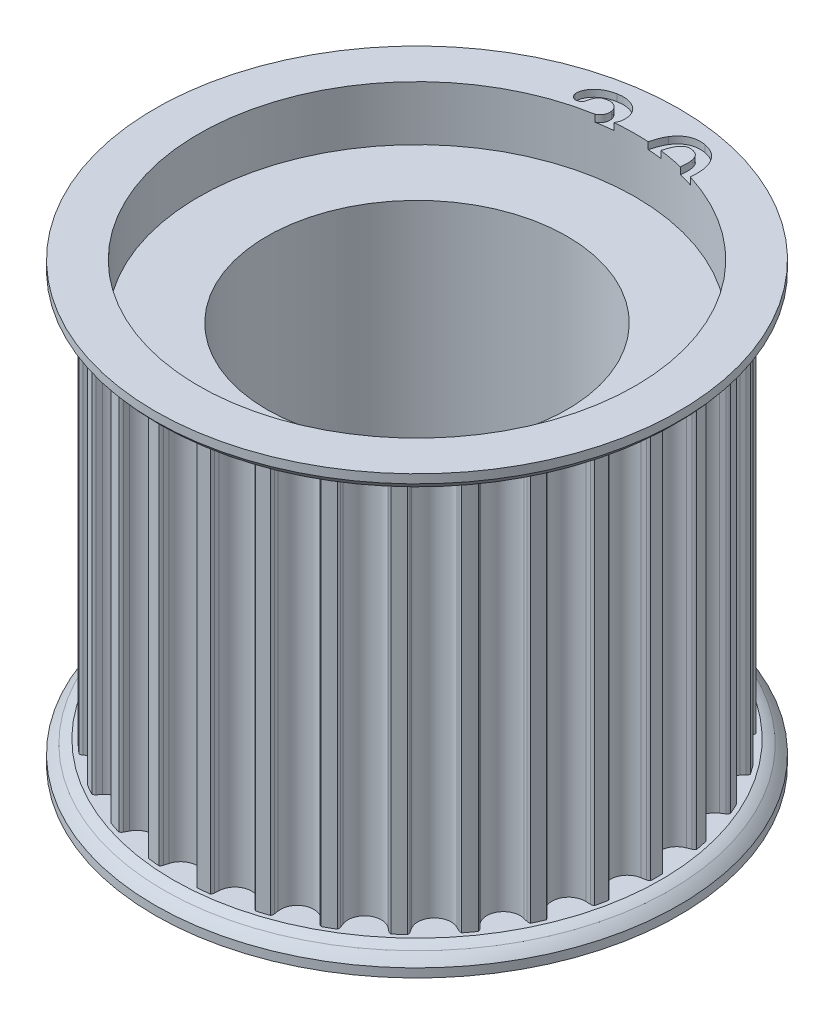
from build123d import *

# Parameters (mm, degrees)
SKETCH1_R                    = 13.942945337
TOOTHOD_DEPTH                = 11.43
TOOTHPROFILE_DEPTH           = 23.791585055
TOOTHPATTERN_COUNT           = 30
BORE_DEPTH                   = 26.016098817
BORE_DEPTH_BACK              = 26.016098817
SKETCH7_R                    = 8.73125
LARGE_TOOTH_COUNT_DEPTH      = 34.311787703
LARGE_TOOTH_COUNT_DEPTH_BACK = 0.4
SKETCH14_W                   = 12.7
SKETCH14_H                   = 3.175


with BuildPart() as part:
    # Sketch1 → ToothOD (new, symmetric)
    with BuildSketch(Plane(origin=(0, 0, 0), x_dir=(1, 0, 0), z_dir=(0, 1, 0))):
        Circle(SKETCH1_R)
    extrude(amount=TOOTHOD_DEPTH, both=True)

    # Sketch2 → ToothProfile (cut, symmetric)
    with BuildSketch(Plane(origin=(0, 0, 0), x_dir=(1, 0, 0), z_dir=(0, 1, 0))):
        with BuildLine():
            ThreePointArc((-0.937033068, 13.493007333), (-0.590385173, 12.974832723), (0, 12.774545337))
            ThreePointArc((0, 12.774545337), (0.590385173, 12.974832723), (0.937033068, 13.493007333))
            ThreePointArc((0.937033068, 13.493007333), (0.971699064, 13.619118795), (1.007805813, 13.744825337))
            ThreePointArc((1.007805813, 13.744825337), (1.04827578, 13.830028138), (1.113221937, 13.898433782))
            ThreePointArc((1.113221937, 13.898433782), (0, 13.942945337), (-1.113221937, 13.898433782))
            ThreePointArc((-1.113221937, 13.898433782), (-1.04827578, 13.830028138), (-1.007805813, 13.744825337))
            ThreePointArc((-1.007805813, 13.744825337), (-0.971699064, 13.619118795), (-0.937033068, 13.493007333))
        make_face()
    toothprofile = extrude(amount=TOOTHPROFILE_DEPTH, both=True, mode=Mode.SUBTRACT)

    # ToothPattern: ToothProfile ×30 about axis
    toothpattern_axis = Axis((0, 11.43, 0), (0, -1, 0))
    for i in range(1, TOOTHPATTERN_COUNT):
        add(toothprofile.rotate(toothpattern_axis, i * 360 / TOOTHPATTERN_COUNT), mode=Mode.SUBTRACT)

    # Sketch4 → Flange (revolve)
    with BuildSketch(Plane.XY):
        with BuildLine():
            Line((0, -11.43), (14.196945337, -11.43))
            ThreePointArc((14.196945337, -11.43), (14.471862303, -11.541433628), (14.732, -11.684))
            ThreePointArc((14.732, -11.684), (15.000284982, -11.923715018), (15.24, -12.192))
            Line((15.24, -12.192), (15.24, -12.7))
            Line((15.24, -12.7), (0, -12.7))
            Line((0, -12.7), (0, -11.43))
        make_face()
        with BuildLine():
            Line((15.24, 12.7), (15.24, 12.192))
            ThreePointArc((15.24, 12.192), (15.000284982, 11.923715018), (14.732, 11.684))
            ThreePointArc((14.732, 11.684), (14.471862303, 11.541433628), (14.196945337, 11.43))
            Line((14.196945337, 11.43), (0, 11.43))
            Line((0, 11.43), (0, 12.7))
            Line((0, 12.7), (15.24, 12.7))
        make_face()
    revolve(axis=Axis((0, 8.73125, 0), (0, -1, 0)))

    # Sketch7 → Bore (cut, two sides: drawn at the far end of the back side and taken through both)
    with BuildSketch(Plane.XZ.offset(-BORE_DEPTH_BACK)):
        Circle(SKETCH7_R)
    extrude(amount=BORE_DEPTH + BORE_DEPTH_BACK, mode=Mode.SUBTRACT)

    # Sketch9 → Large Tooth Count (cut, two sides: drawn at the far end of the back side and taken through both)
    # profile 1 of 2: a face of its own
    with BuildSketch(Plane(origin=(0, 12.7, 0), x_dir=(1, 0, 0), z_dir=(0, 1, 0)).offset(-LARGE_TOOTH_COUNT_DEPTH_BACK)):
        with BuildLine():
            add(Edge.make_bspline(
                [(-2.395395166, 12.44030561), (-2.351764935, 12.449788273), (-2.26636482, 12.468349267), (-2.148342517, 12.521687794), (-2.042804555, 12.591006059), (-1.96740896, 12.663473497), (-1.915871931, 12.728738206), (-1.883660529, 12.781439315), (-1.858242003, 12.837454575), (-1.840411306, 12.896637263), (-1.829894588, 12.959037271), (-1.825356933, 13.024243133), (-1.828016507, 13.092828085), (-1.835316428, 13.138960651), (-1.839075635, 13.162717329)],
                knots=[0, 0, 0, 0, 1.56408417, 3.061477405, 4.516692484, 5.980328475, 6.71001621, 7.432406507, 8.143441474, 8.864242186, 9.596246751, 10.361021371, 11.155982632, 12, 12, 12, 12], degree=3))
            add(Edge.make_bspline(
                [(-1.839075635, 13.162717329), (-1.847468614, 13.198321462), (-1.863918276, 13.268103117), (-1.912945679, 13.363762957), (-1.979770738, 13.4477246), (-2.063508364, 13.518748482), (-2.161688264, 13.573950381), (-2.272366388, 13.606154076), (-2.39306776, 13.616531188), (-2.474963903, 13.604676737), (-2.517731885, 13.598486079)],
                knots=[0, 0, 0, 0, 0.970242947, 1.901609501, 2.831594879, 3.809017159, 4.805027202, 5.804681963, 6.853556249, 8, 8, 8, 8], degree=3))
            add(Edge.make_bspline(
                [(-2.517731885, 13.598486079), (-2.546415601, 13.592694971), (-2.601323677, 13.581609287), (-2.678208847, 13.55850786), (-2.746350603, 13.530836409), (-2.805384858, 13.497992457), (-2.855844248, 13.460479936), (-2.900373354, 13.421487835), (-2.937064484, 13.378096327), (-2.978986878, 13.315102944), (-3.020518734, 13.221832551), (-3.059478235, 13.098283973), (-3.093381877, 12.968046045), (-3.114639047, 12.880861708), (-3.124950635, 12.838569673)],
                knots=[0, 0, 0, 0, 0.994372717, 1.903487376, 2.72466848, 3.490292993, 4.192582868, 4.858964158, 5.497730828, 6.117954991, 7.426137334, 8.949273991, 10.520130824, 12, 12, 12, 12], degree=3))
            add(Edge.make_bspline(
                [(-3.124950635, 12.838569673), (-3.129102288, 12.828888525), (-3.137555782, 12.809176013), (-3.156946896, 12.781271911), (-3.184316211, 12.757087617), (-3.228365663, 12.724989234), (-3.296869514, 12.693279737), (-3.356792915, 12.679657358), (-3.388376416, 12.672477485)],
                knots=[0, 0, 0, 0, 0.583215557, 1.187529019, 1.864732099, 2.597558886, 4.206693834, 6, 6, 6, 6], degree=3))
            add(Edge.make_bspline(
                [(-3.388376416, 12.672477485), (-3.408006408, 12.670159859), (-3.447059185, 12.665549071), (-3.507022694, 12.67355228), (-3.566425146, 12.693523488), (-3.623655514, 12.725811297), (-3.677136394, 12.767570228), (-3.718303855, 12.823277744), (-3.750834042, 12.887407726), (-3.76148388, 12.935253341), (-3.766995166, 12.960013423)],
                knots=[0, 0, 0, 0, 0.895545026, 1.78163704, 2.722927117, 3.728259503, 4.757347425, 5.780279766, 6.851295854, 8, 8, 8, 8], degree=3))
            add(Edge.make_bspline(
                [(-3.766995166, 12.960013423), (-3.770411448, 12.985862618), (-3.777384046, 13.038620566), (-3.773919219, 13.121047331), (-3.759263587, 13.207335205), (-3.733005125, 13.296987906), (-3.696578666, 13.389099655), (-3.647932397, 13.480993304), (-3.588113382, 13.572735702), (-3.518084365, 13.664428947), (-3.436036471, 13.753650839), (-3.341843972, 13.838087605), (-3.234599648, 13.915677391), (-3.115927699, 13.987966339), (-2.986130398, 14.052791424), (-2.845920922, 14.108605922), (-2.695743201, 14.153101315), (-2.591436102, 14.174340706), (-2.538270166, 14.185166548)],
                knots=[0, 0, 0, 0, 0.657648442, 1.342253878, 2.074039585, 2.864148476, 3.697712609, 4.572156031, 5.485651204, 6.461680898, 7.483386968, 8.543039874, 9.651430748, 10.822328438, 12.049685541, 13.311901225, 14.629860395, 16, 16, 16, 16], degree=3))
            add(Edge.make_bspline(
                [(-2.538270166, 14.185166548), (-2.491323817, 14.192598445), (-2.399252753, 14.207173862), (-2.262542202, 14.218659249), (-2.130523977, 14.21615243), (-2.003510296, 14.205171913), (-1.88150585, 14.182798989), (-1.765492151, 14.149880101), (-1.655706619, 14.106812961), (-1.552939002, 14.053959346), (-1.457386459, 13.992879421), (-1.37142964, 13.922784448), (-1.294282136, 13.845573559), (-1.228614102, 13.759473777), (-1.172184525, 13.667230001), (-1.12544845, 13.569517), (-1.089148427, 13.465869789), (-1.073635459, 13.393899723), (-1.065764698, 13.357384517)],
                knots=[0, 0, 0, 0, 1.205963252, 2.365132143, 3.475536425, 4.552557823, 5.596986774, 6.617881568, 7.608112011, 8.584359298, 9.54600503, 10.480268389, 11.393565618, 12.30907766, 13.221030907, 14.133203077, 15.052849641, 16, 16, 16, 16], degree=3))
            add(Edge.make_bspline(
                [(-1.065764698, 13.357384517), (-1.058444517, 13.309874096), (-1.044223716, 13.217576343), (-1.046060272, 13.080838704), (-1.062999475, 12.95140843), (-1.100190083, 12.829006806), (-1.152753369, 12.710344301), (-1.218197892, 12.591451706), (-1.297956271, 12.471597027), (-1.359266437, 12.394328645), (-1.390805323, 12.35458061)],
                knots=[0, 0, 0, 0, 1.053632123, 2.04687467, 2.990381272, 3.91042597, 4.843946409, 5.835317206, 6.886454128, 8, 8, 8, 8], degree=3))
            add(Edge.make_bspline(
                [(-1.390805323, 12.35458061), (-1.350412041, 12.340545314), (-1.270980886, 12.312945681), (-1.157752588, 12.262979632), (-1.052586502, 12.206626181), (-0.956144809, 12.143795096), (-0.867013097, 12.07655175), (-0.788401054, 12.001417094), (-0.716721652, 11.921931915), (-0.655517404, 11.83490394), (-0.602231291, 11.742811281), (-0.559592513, 11.644667954), (-0.524881708, 11.541361692), (-0.509910371, 11.46953943), (-0.502301416, 11.43303686)],
                knots=[0, 0, 0, 0, 1.139891914, 2.24153439, 3.296229475, 4.31773043, 5.308329865, 6.268443975, 7.212979858, 8.157782482, 9.099914282, 10.045216846, 11.006511264, 12, 12, 12, 12], degree=3))
            add(Edge.make_bspline(
                [(-0.502301416, 11.43303686), (-0.495319451, 11.388490119), (-0.481414307, 11.299771707), (-0.478916202, 11.164667165), (-0.488260491, 11.029415833), (-0.51276627, 10.894860542), (-0.549846959, 10.762327063), (-0.602249742, 10.634138329), (-0.667869204, 10.510393731), (-0.746222597, 10.391484268), (-0.838347041, 10.280067973), (-0.942787724, 10.17663575), (-1.059215889, 10.081986318), (-1.186989884, 9.996266633), (-1.325681923, 9.920701304), (-1.475651654, 9.858916788), (-1.635068246, 9.806633217), (-1.746512528, 9.78436586), (-1.803356885, 9.773007954)],
                knots=[0, 0, 0, 0, 0.919196757, 1.830654129, 2.750292315, 3.682047259, 4.616530511, 5.553871909, 6.502170786, 7.470871317, 8.454707972, 9.446890999, 10.465768377, 11.511964047, 12.582837701, 13.682741819, 14.818036711, 16, 16, 16, 16], degree=3))
            add(Edge.make_bspline(
                [(-1.803356885, 9.773007954), (-1.861273881, 9.764095157), (-1.97457734, 9.746658985), (-2.143413115, 9.740832432), (-2.305966452, 9.751048954), (-2.461225746, 9.778889999), (-2.606979598, 9.821119725), (-2.742928406, 9.873090337), (-2.868308727, 9.934276457), (-2.981900004, 10.005903776), (-3.083286845, 10.085279788), (-3.175837052, 10.166704637), (-3.256567319, 10.253286516), (-3.326556915, 10.341337364), (-3.383639504, 10.428572924), (-3.428783069, 10.510279282), (-3.462785872, 10.585170072), (-3.474766814, 10.634802087), (-3.480352198, 10.657939985)],
                knots=[0, 0, 0, 0, 1.358988971, 2.658600414, 3.911700577, 5.132627013, 6.311151581, 7.428568411, 8.506776026, 9.543649576, 10.538503265, 11.492538343, 12.401569204, 13.281931069, 14.10006001, 14.817332809, 15.448653585, 16, 16, 16, 16], degree=3))
            add(Edge.make_bspline(
                [(-3.480352198, 10.657939985), (-3.483746984, 10.68497257), (-3.490277506, 10.736974917), (-3.483346924, 10.814189742), (-3.459407148, 10.885488216), (-3.420429227, 10.949801807), (-3.370073369, 11.006058136), (-3.308307685, 11.050542415), (-3.238271172, 11.084475844), (-3.186891971, 11.095909843), (-3.160669385, 11.101745454)],
                knots=[0, 0, 0, 0, 1.065165672, 2.049049875, 3.00773798, 3.985592617, 4.976224793, 5.944087156, 6.950716419, 8, 8, 8, 8], degree=3))
            add(Edge.make_bspline(
                [(-3.160669385, 11.101745454), (-3.132597094, 11.104682386), (-3.07565053, 11.110640153), (-3.005449066, 11.091014031), (-2.953679925, 11.068571016), (-2.91939304, 11.047595496), (-2.891337116, 11.023070197), (-2.877833025, 11.003226451), (-2.87134751, 10.993696235)],
                knots=[0, 0, 0, 0, 1.550673656, 3.145647615, 3.957272918, 4.675311549, 5.363801208, 6, 6, 6, 6], degree=3))
            add(Edge.make_bspline(
                [(-2.87134751, 10.993696235), (-2.834765451, 10.934439869), (-2.765769991, 10.822679615), (-2.654254449, 10.673931939), (-2.546873402, 10.549804547), (-2.454600564, 10.465849729), (-2.379391167, 10.412984746), (-2.320630434, 10.38270277), (-2.259082437, 10.358414541), (-2.19377006, 10.341195919), (-2.12514281, 10.331648111), (-2.053345183, 10.329022341), (-1.978350806, 10.333749213), (-1.927728345, 10.341432664), (-1.901583448, 10.345400923)],
                knots=[0, 0, 0, 0, 1.989651524, 3.75257504, 5.30775678, 6.675689646, 7.305821198, 7.929950262, 8.560368956, 9.193937615, 9.855728221, 10.536870827, 11.244340126, 12, 12, 12, 12], degree=3))
            add(Edge.make_bspline(
                [(-1.901583448, 10.345400923), (-1.871644399, 10.352199583), (-1.811653801, 10.36582245), (-1.724531025, 10.397969414), (-1.641916359, 10.442636299), (-1.563158271, 10.496780316), (-1.491100009, 10.561890428), (-1.427079449, 10.636365346), (-1.373201458, 10.72071369), (-1.328532708, 10.813025229), (-1.296080307, 10.912955075), (-1.279366413, 11.018302819), (-1.277092498, 11.127852865), (-1.287926429, 11.200953457), (-1.293471729, 11.238369673)],
                knots=[0, 0, 0, 0, 0.918783497, 1.841019456, 2.770121856, 3.724533536, 4.696473957, 5.670047891, 6.656552307, 7.685126467, 8.733743146, 9.79028542, 10.868967352, 12, 12, 12, 12], degree=3))
            add(Edge.make_bspline(
                [(-1.293471729, 11.238369673), (-1.298936686, 11.265876176), (-1.30961674, 11.319631579), (-1.333478309, 11.396401406), (-1.360287624, 11.468479114), (-1.394965812, 11.533732243), (-1.433076599, 11.593785038), (-1.476357011, 11.648422925), (-1.525805682, 11.69629192), (-1.579318811, 11.739547501), (-1.637253652, 11.775881164), (-1.698731759, 11.806115638), (-1.76434029, 11.827990482), (-1.83303783, 11.844288015), (-1.905487999, 11.853175874), (-1.98114044, 11.854782163), (-2.060573072, 11.849194939), (-2.114159971, 11.840923764), (-2.141792041, 11.836658735)],
                knots=[0, 0, 0, 0, 1.142167213, 2.232114242, 3.272952444, 4.271354239, 5.237162538, 6.16931723, 7.104388237, 8.036542928, 8.968855492, 9.885808178, 10.82190168, 11.781211808, 12.759285311, 13.790748962, 14.860800298, 16, 16, 16, 16], degree=3))
            add(Edge.make_bspline(
                [(-2.141792041, 11.836658735), (-2.152794304, 11.834231238), (-2.177762529, 11.828722342), (-2.219583134, 11.820746399), (-2.268450918, 11.806036359), (-2.322602613, 11.792515486), (-2.374969303, 11.777315582), (-2.420194021, 11.766479519), (-2.454197188, 11.756940782), (-2.473367184, 11.752663579), (-2.481120166, 11.750933735)],
                knots=[0, 0, 0, 0, 0.772488785, 1.753064323, 2.916415325, 4.267721891, 5.579625089, 6.653636691, 7.455485957, 8, 8, 8, 8], degree=3))
            add(Edge.make_bspline(
                [(-2.481120166, 11.750933735), (-2.506960456, 11.746913438), (-2.556158075, 11.739259148), (-2.627480161, 11.7445519), (-2.692385424, 11.758886393), (-2.748894318, 11.788116673), (-2.797532533, 11.827971419), (-2.835684342, 11.879578873), (-2.863495022, 11.941556302), (-2.873931957, 11.987031385), (-2.879384229, 12.010787642)],
                knots=[0, 0, 0, 0, 1.158395447, 2.205482207, 3.158342672, 4.093034092, 5.004217035, 5.930162721, 6.91871368, 8, 8, 8, 8], degree=3))
            add(Edge.make_bspline(
                [(-2.879384229, 12.010787642), (-2.882631581, 12.034581517), (-2.888938576, 12.080793902), (-2.878805561, 12.149340934), (-2.856720158, 12.213565122), (-2.817758689, 12.271771874), (-2.764205594, 12.323365118), (-2.69486753, 12.365228304), (-2.61067647, 12.39742537), (-2.548927529, 12.410824563), (-2.515945948, 12.417981392)],
                knots=[0, 0, 0, 0, 0.930670598, 1.807545321, 2.668967297, 3.556120476, 4.506850782, 5.542439393, 6.687358266, 8, 8, 8, 8], degree=3))
            Line((-2.515945948, 12.417981392), (-2.395395166, 12.44030561))
        make_face()
    # profile 2 of 2: a face of its own
    with BuildSketch(Plane(origin=(0, 12.7, 0), x_dir=(1, 0, 0), z_dir=(0, 1, 0)).offset(-LARGE_TOOTH_COUNT_DEPTH_BACK)):
        with BuildLine():
            add(Edge.make_bspline(
                [(3.7004625, 11.677153906), (3.686264675, 11.601404519), (3.658870865, 11.455250838), (3.60823368, 11.246398968), (3.555331302, 11.054842095), (3.497140597, 10.879874057), (3.43226392, 10.718370387), (3.354284746, 10.5696501), (3.267863441, 10.429406438), (3.200079147, 10.344222093), (3.166467187, 10.301982031)],
                knots=[0, 0, 0, 0, 1.239292749, 2.391137464, 3.455110319, 4.434576526, 5.35558113, 6.250576262, 7.132519381, 8, 8, 8, 8], degree=3))
            add(Edge.make_bspline(
                [(3.166467187, 10.301982031), (3.144198164, 10.275762567), (3.099982848, 10.223703623), (3.028150759, 10.152099925), (2.955162603, 10.084262728), (2.878202286, 10.023683343), (2.798344121, 9.969152553), (2.716313748, 9.919700373), (2.631008556, 9.876989925), (2.515006197, 9.826838731), (2.364496556, 9.780916237), (2.178286013, 9.751180687), (1.987209688, 9.746705952), (1.860205836, 9.764969839), (1.795760156, 9.7742375)],
                knots=[0, 0, 0, 0, 0.801914036, 1.592206392, 2.363614895, 3.12467816, 3.873679032, 4.617741915, 5.356605588, 6.096739935, 7.563535306, 9.011766561, 10.483677989, 12, 12, 12, 12], degree=3))
            add(Edge.make_bspline(
                [(1.795760156, 9.7742375), (1.758691219, 9.781631242), (1.685306753, 9.796268451), (1.579017325, 9.829261717), (1.47669898, 9.867783469), (1.380044445, 9.916590329), (1.285561627, 9.968935939), (1.19738272, 10.03240735), (1.113160926, 10.102133163), (1.033456371, 10.178910635), (0.960133443, 10.26276729), (0.891273319, 10.351207984), (0.831227587, 10.446296886), (0.776093193, 10.545504009), (0.728929808, 10.650561093), (0.688129265, 10.760416841), (0.652394743, 10.875273666), (0.635471729, 10.954585081), (0.626864062, 10.994925781)],
                knots=[0, 0, 0, 0, 1.006831006, 1.993198655, 2.962670514, 3.917125603, 4.876579595, 5.838523297, 6.807605523, 7.789496056, 8.784377988, 9.774567055, 10.773710418, 11.778570219, 12.797611708, 13.839467994, 14.90107403, 16, 16, 16, 16], degree=3))
            add(Edge.make_bspline(
                [(0.626864062, 10.994925781), (0.619759274, 11.038311971), (0.605309332, 11.126552166), (0.593814246, 11.262326323), (0.586896602, 11.40293425), (0.589152193, 11.548709409), (0.598648225, 11.69935456), (0.612502788, 11.855226338), (0.63412349, 12.015735441), (0.65299437, 12.123994877), (0.662582812, 12.179002344)],
                knots=[0, 0, 0, 0, 0.885671199, 1.801305883, 2.744009489, 3.721842217, 4.73736564, 5.785511931, 6.874801293, 8, 8, 8, 8], degree=3))
            add(Edge.make_bspline(
                [(0.662582812, 12.179002344), (0.67581353, 12.249342885), (0.701685694, 12.38689113), (0.747177039, 12.586095152), (0.796532307, 12.77366033), (0.848666183, 12.949364152), (0.905121765, 13.112699737), (0.967526733, 13.262167279), (1.031048043, 13.399729724), (1.08126072, 13.48342074), (1.105495312, 13.523813281)],
                knots=[0, 0, 0, 0, 1.20660685, 2.359473668, 3.444007557, 4.475997896, 5.44888863, 6.355661217, 7.206378115, 8, 8, 8, 8], degree=3))
            add(Edge.make_bspline(
                [(1.105495312, 13.523813281), (1.126834416, 13.556524286), (1.168832216, 13.62090329), (1.237568178, 13.7114371), (1.311190111, 13.793654963), (1.38803844, 13.868988013), (1.468633631, 13.937022551), (1.552525179, 13.998072286), (1.640742164, 14.051107199), (1.732849104, 14.096474687), (1.827852868, 14.135111111), (1.926359063, 14.164557494), (2.026980006, 14.186607394), (2.130423165, 14.202480291), (2.236825853, 14.208279031), (2.345683237, 14.206147175), (2.457347204, 14.197656756), (2.53193532, 14.185467192), (2.569964062, 14.179252344)],
                knots=[0, 0, 0, 0, 1.092656575, 2.150473306, 3.176936881, 4.178220762, 5.159348138, 6.12565659, 7.078409122, 8.035701623, 8.996177392, 9.944733961, 10.908670395, 11.876915267, 12.869780463, 13.886055898, 14.922205845, 16, 16, 16, 16], degree=3))
            add(Edge.make_bspline(
                [(2.569964062, 14.179252344), (2.619624638, 14.169226826), (2.716840932, 14.14960072), (2.855875094, 14.103943551), (2.985902625, 14.04899947), (3.106389503, 13.982386476), (3.217471903, 13.905565708), (3.318837426, 13.818133593), (3.411769076, 13.721779129), (3.492574376, 13.613505622), (3.565776041, 13.496705298), (3.628707217, 13.369762396), (3.683047683, 13.233001098), (3.710511229, 13.137130565), (3.724572656, 13.088044531)],
                knots=[0, 0, 0, 0, 1.079729077, 2.11369401, 3.114862735, 4.086675933, 5.044705033, 5.990156637, 6.93763101, 7.893743987, 8.866158368, 9.874067695, 10.911515541, 12, 12, 12, 12], degree=3))
            add(Edge.make_bspline(
                [(3.724572656, 13.088044531), (3.735099244, 13.042639356), (3.756896756, 12.948618401), (3.776692586, 12.799831487), (3.786882924, 12.639950564), (3.788716644, 12.468830024), (3.780101474, 12.286771755), (3.762793048, 12.093481855), (3.737219973, 11.888738889), (3.712960493, 11.749095406), (3.7004625, 11.677153906)],
                knots=[0, 0, 0, 0, 0.786691818, 1.629010692, 2.530719007, 3.490774846, 4.517115952, 5.606966069, 6.767157296, 8, 8, 8, 8], degree=3))
        make_face()
        with BuildLine():
            add(Edge.make_bspline(
                [(2.910185156, 11.880750781), (2.924410495, 11.964603932), (2.951486621, 12.124207756), (2.981874031, 12.353435144), (2.998161754, 12.560314022), (3.002720248, 12.745834185), (2.993973814, 12.911553595), (2.969933101, 13.058716639), (2.929909935, 13.187754947), (2.874474497, 13.299155576), (2.801281854, 13.393285072), (2.706839088, 13.465754997), (2.594968943, 13.521017292), (2.511607524, 13.539292631), (2.468165625, 13.548816406)],
                knots=[0, 0, 0, 0, 1.58388521, 3.014724367, 4.304646265, 5.446791372, 6.468588601, 7.390852584, 8.216588302, 8.975197153, 9.697217003, 10.415802656, 11.174431761, 12, 12, 12, 12], degree=3))
            add(Edge.make_bspline(
                [(2.468165625, 13.548816406), (2.436099139, 13.553635955), (2.373958902, 13.562975546), (2.28175461, 13.560981921), (2.19488034, 13.545989423), (2.113334219, 13.517012945), (2.037360483, 13.474327837), (1.967074016, 13.41802768), (1.902473026, 13.348317888), (1.843437621, 13.265140408), (1.789523086, 13.168320816), (1.73651258, 13.059109551), (1.687078599, 12.935681177), (1.639915098, 12.798842122), (1.595270597, 12.648373065), (1.553834599, 12.483761428), (1.513386631, 12.30550906), (1.489963339, 12.181465967), (1.477863281, 12.1173875)],
                knots=[0, 0, 0, 0, 0.799431854, 1.549183897, 2.265673805, 2.967656902, 3.675043338, 4.407302646, 5.182031398, 6.014136202, 6.91929923, 7.915230763, 9.009728297, 10.199692224, 11.487861376, 12.88351287, 14.390077883, 16, 16, 16, 16], degree=3))
            add(Edge.make_bspline(
                [(1.477863281, 12.1173875), (1.469909645, 12.073370146), (1.454350245, 11.987260657), (1.435180844, 11.860614905), (1.417742779, 11.739855671), (1.404360242, 11.62491711), (1.39461089, 11.515612691), (1.387442469, 11.412010626), (1.382646763, 11.314060687), (1.381493996, 11.194285407), (1.387489531, 11.056488406), (1.412169879, 10.905691302), (1.451053834, 10.773132799), (1.5049595, 10.658369923), (1.577720936, 10.562545304), (1.669426393, 10.488079638), (1.778682067, 10.432487804), (1.859764301, 10.414203177), (1.902023437, 10.404673438)],
                knots=[0, 0, 0, 0, 1.091371878, 2.135009643, 3.125165946, 4.06839428, 4.95806396, 5.802562953, 6.602308193, 7.350423399, 8.725033855, 9.962033809, 11.0695267, 12.086256579, 13.039221506, 13.978470784, 14.946402002, 16, 16, 16, 16], degree=3))
            add(Edge.make_bspline(
                [(1.902023437, 10.404673438), (1.924587882, 10.400887995), (1.968620661, 10.393500995), (2.034218783, 10.391230619), (2.097039875, 10.394553102), (2.157236001, 10.404407116), (2.214533549, 10.420356358), (2.269153619, 10.443080638), (2.320855396, 10.472717028), (2.387733076, 10.521499558), (2.464921351, 10.599186031), (2.548360565, 10.711042387), (2.622168921, 10.845258606), (2.675987846, 10.971459008), (2.716902488, 11.083645194), (2.746809929, 11.177012017), (2.776420898, 11.277314053), (2.804882222, 11.384536629), (2.832457187, 11.498592767), (2.859088379, 11.619852486), (2.886241044, 11.747671693), (2.902089886, 11.835758045), (2.910185156, 11.880750781)],
                knots=[0, 0, 0, 0, 0.687381122, 1.341371444, 1.968978725, 2.576739265, 3.171843679, 3.753672719, 4.350994545, 4.959743046, 6.238357749, 7.625796228, 9.144683334, 10.832503885, 11.74714998, 12.735073917, 13.780221821, 14.891903747, 16.070782631, 17.308674638, 18.625325182, 20, 20, 20, 20], degree=3))
        make_face(mode=Mode.SUBTRACT)
    extrude(amount=LARGE_TOOTH_COUNT_DEPTH + LARGE_TOOTH_COUNT_DEPTH_BACK, mode=Mode.SUBTRACT)

    # Sketch14 → Cut-Revolve1 (revolve, cut)
    with BuildSketch(Plane.XY):
        with Locations((6.35, 11.1125)):
            Rectangle(SKETCH14_W, SKETCH14_H)
        with Locations((6.35, -11.1125)):
            Rectangle(SKETCH14_W, SKETCH14_H)
    revolve(axis=Axis((0, 0, 0), (0, 1, 0)), mode=Mode.SUBTRACT)


solid = part.part
